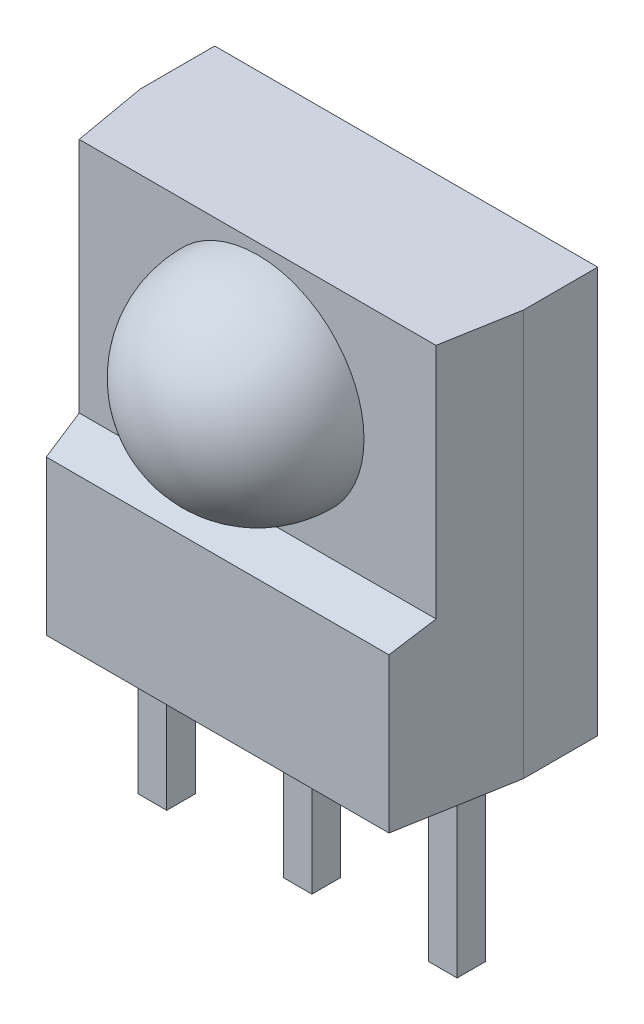
from build123d import *
from OCP.BRepFilletAPI import BRepFilletAPI_MakeChamfer

# Parameters (mm, degrees)
ESBO_O1_W                = 6.7
ESBO_O1_H                = 3.3
RESSALTO_EXTRUS_O1_DEPTH = 7.1
ESBO_O2_W                = 6.7
ESBO_O2_H                = 4.1
CORTE_EXTRUS_O1_DEPTH    = 0.7
REVOLU_O1_ANGLE          = 180
ESBO_O4_W                = 0.5
ESBO_O4_H                = 0.5
RESSALTO_EXTRUS_O2_DEPTH = 3
CHANFRO1_SIZE            = 0.3
CHANFRO1_SIZE_2          = 0.824243226
CHANFRO2_SIZE            = 2
CHANFRO2_SIZE2           = 0.352653961


with BuildPart() as part:
    # Esboço1 → Ressalto-extrusão1 (new body)
    with BuildSketch(Plane(origin=(0, 0, 0), x_dir=(1, 0, 0), z_dir=(0, 1, 0))):
        Rectangle(ESBO_O1_W, ESBO_O1_H)
    extrude(amount=RESSALTO_EXTRUS_O1_DEPTH)

    # Esboço2 → Corte-extrusão1 (cut)
    with BuildSketch(Plane.XY.offset(1.65)):
        with Locations((0, 5.05)):
            Rectangle(ESBO_O2_W, ESBO_O2_H)
    extrude(amount=-CORTE_EXTRUS_O1_DEPTH, mode=Mode.SUBTRACT)

    # Esboço3 → Revolução1 (revolve)
    with BuildSketch(Plane.XY.offset(0.95)):
        with BuildLine():
            Line((0, 6.911003495), (0, 3.188996505))
            ThreePointArc((0, 3.188996505), (1.861003495, 5.05), (0, 6.911003495))
        make_face()
    revolve(axis=Axis((0, 7.1, 0.95), (0, -1, 0)), revolution_arc=REVOLU_O1_ANGLE)

    # Esboço4 → Ressalto-extrusão2 (add)
    with BuildSketch(Plane.XZ):
        Rectangle(ESBO_O4_W, ESBO_O4_H)
        with Locations((-2.54, 0)):
            Rectangle(ESBO_O4_W, ESBO_O4_H)
        with Locations((2.54, 0)):
            Rectangle(ESBO_O4_W, ESBO_O4_H)
    extrude(amount=RESSALTO_EXTRUS_O2_DEPTH)

    # Chanfro1
    # the kernel refuses this chamfer: 0.824243226, 0.3 mm, written as the material it takes off along each edge
    with BuildSketch(Plane(origin=(5.488247435, 3, 1.65), x_dir=(0, -0.9950833631817485, 0.09904090225205103), z_dir=(-1, 0, 0))) as chanfro1_piece_1_section:
        Polygon((CHANFRO1_SIZE * 0.995083363182, -CHANFRO1_SIZE * 0.0990409022521), (-CHANFRO1_SIZE_2 * 0.0990409022324, -CHANFRO1_SIZE_2 * 0.995083362984), (0, 0), align=None)
    chanfro1_piece_1 = extrude(amount=10.97649487, mode=Mode.PRIVATE)
    chanfro1_piece_1 = split(chanfro1_piece_1, bisect_by=Plane(origin=(0, 2.90340276, 0.95), z_dir=(0, 0, 1)), keep=Keep.TOP, mode=Mode.PRIVATE)
    add(chanfro1_piece_1, mode=Mode.SUBTRACT)

    # Chanfro2: one chamfer whose edges measure the first distance from different faces: ONE call of the kernel's chamfer builder (chamfer() names one face for all edges)
    chanfro2_edges_1 = [part.edges().sort_by_distance(p)[0] for p in [
        (3.35, 1.35, 1.65),
    ]]
    chanfro2_side_1 = [part.faces().sort_by_distance(p)[0] for p in [
        (3.35, 3.34322922, -0.190735653),
    ]]
    chanfro2_edges_2 = [part.edges().sort_by_distance(p)[0] for p in [
        (-3.35, 1.35, 1.65),
    ]]
    chanfro2_side_2 = [part.faces().sort_by_distance(p)[0] for p in [
        (-3.35, 3.34322922, -0.190735653),
    ]]
    chanfro2 = BRepFilletAPI_MakeChamfer(part.part.solid().wrapped)
    for e in chanfro2_edges_1:
        chanfro2.Add(CHANFRO2_SIZE, CHANFRO2_SIZE2, e.wrapped, chanfro2_side_1[0].wrapped)  # the first distance lies on this face
    for e in chanfro2_edges_2:
        chanfro2.Add(CHANFRO2_SIZE, CHANFRO2_SIZE2, e.wrapped, chanfro2_side_2[0].wrapped)  # the first distance lies on this face
    add(Compound.cast(chanfro2.Shape()), mode=Mode.REPLACE)


solid = part.part
